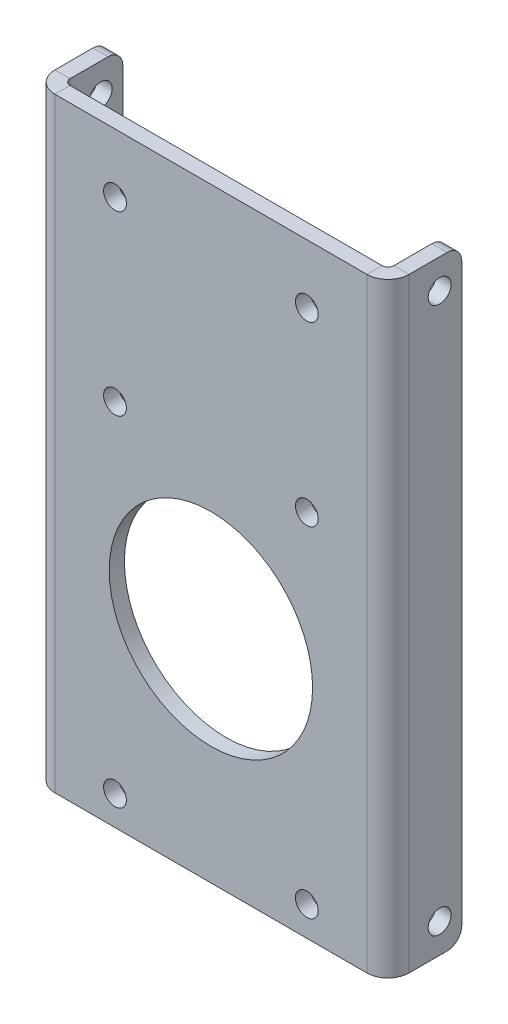
from build123d import *

# Parameters (mm, degrees)
SKETCH1_W                      = 76.2
SKETCH1_H                      = 130.175
BASE_FLANGE1_DEPTH             = 3.2639
EDGE_FLANGE1_STRIP_W           = 15.5956
EDGE_FLANGE1_STRIP_H           = 3.2639
EDGE_FLANGE1_STRIP_CUT_DEPTH   = 130.175
EDGE_FLANGE1_STRIP_2_W         = 15.5956
EDGE_FLANGE1_STRIP_2_H         = 3.2639
EDGE_FLANGE1_STRIP_CUT_2_DEPTH = 130.175
EDGE_FLANGE1_DEPTH             = 130.175
EDGE_FLANGE1_BEND_DEPTH        = 130.175
F_10_0_1935_DIAMETER_HOLE1_D   = 4.9149
SKETCH32_R                     = 21.87575
CUT_EXTRUDE1_DEPTH             = 93.055303045
F_10_0_1935_DIAMETER_HOLE2_D   = 4.9149
FILLET1_R                      = 3.175
F_10_0_1935_DIAMETER_HOLE3_D   = 4.9149


# Sheet-metal steps are written as plain solids
with BuildPart() as part:
    # Sketch1 → Base-Flange1 (new body)
    with BuildSketch(Plane.XY):
        with Locations((0, 17.758918)):
            Rectangle(SKETCH1_W, SKETCH1_H)
    extrude(amount=-BASE_FLANGE1_DEPTH)

    # Edge-Flange1 strip (across the edge) → Edge-Flange1 strip cut (cut)
    with BuildSketch(Plane(origin=(38.1, 82.846418, -3.2639), x_dir=(-1, 0, 0), z_dir=(0, -1, 0))):
        with Locations((-3.2639, -1.63195)):
            Rectangle(EDGE_FLANGE1_STRIP_W, EDGE_FLANGE1_STRIP_H)
    extrude(amount=EDGE_FLANGE1_STRIP_CUT_DEPTH, mode=Mode.SUBTRACT)

    # Edge-Flange1 strip 2 (across the edge) → Edge-Flange1 strip cut 2 (cut)
    with BuildSketch(Plane(origin=(-38.1, -47.328582, -3.2639), x_dir=(1, 0, 0), z_dir=(0, 1, 0))):
        with Locations((-3.2639, -1.63195)):
            Rectangle(EDGE_FLANGE1_STRIP_2_W, EDGE_FLANGE1_STRIP_2_H)
    extrude(amount=EDGE_FLANGE1_STRIP_CUT_2_DEPTH, mode=Mode.SUBTRACT)

    # Edge-Flange1 section (across the edge) → Edge-Flange1 (add)
    with BuildSketch(Plane(origin=(38.1, 82.846418, -3.2639), x_dir=(-1, 0, 0), z_dir=(0, -1, 0))):
        with BuildLine():
            Line((0, 1.27), (0, 12.6111))
            Line((0, 12.6111), (3.2639, 12.6111))
            Line((3.2639, 12.6111), (3.2639, 1.27))
            ThreePointArc((3.2639, 1.27), (3.635874388, 0.371974388), (4.5339, 0))
            Line((4.5339, 0), (4.5339, -3.2639))
            ThreePointArc((4.5339, -3.2639), (1.327948565, -1.935951435), (0, 1.27))
        make_face()
    extrude(amount=EDGE_FLANGE1_DEPTH)

    # Edge-Flange1 section 2 (across the edge) → Edge-Flange1 bend (add)
    with BuildSketch(Plane(origin=(-38.1, -47.328582, -3.2639), x_dir=(1, 0, 0), z_dir=(0, 1, 0))):
        with BuildLine():
            Line((0, 1.27), (0, 12.6111))
            Line((0, 12.6111), (3.2639, 12.6111))
            Line((3.2639, 12.6111), (3.2639, 1.27))
            ThreePointArc((3.2639, 1.27), (3.635874388, 0.371974388), (4.5339, 0))
            Line((4.5339, 0), (4.5339, -3.2639))
            ThreePointArc((4.5339, -3.2639), (1.327948565, -1.935951435), (0, 1.27))
        make_face()
    extrude(amount=EDGE_FLANGE1_BEND_DEPTH)

    # #10 (0.1935) Diameter Hole1 (through all)
    with Locations(Plane(origin=(38.1, 0, 0), x_dir=(0, 0, -1), z_dir=(1, 0, 0))):
        with Locations((11.1125, 76.496418), (11.1125, -40.978582)):
            Hole(F_10_0_1935_DIAMETER_HOLE1_D / 2)

    # Sketch32 → Cut-Extrude1 (cut, through all)
    with BuildSketch(Plane(origin=(0, 0, -3.2639), x_dir=(-1, 0, 0), z_dir=(0, 0, -1))):
        Circle(SKETCH32_R)
    extrude(amount=-CUT_EXTRUDE1_DEPTH, mode=Mode.SUBTRACT)

    # #10 (0.1935) Diameter Hole2 (through all)
    with Locations(Plane.XY):
        with Locations((-20.6375, -40.978582), (20.6375, -40.978582)):
            Hole(F_10_0_1935_DIAMETER_HOLE2_D / 2)

    # Fillet1
    fillet1_edges = [part.edges().sort_by_distance(p)[0] for p in [
        (36.46805, 82.846418, -15.875),
        (36.46805, -47.328582, -15.875),
        (-36.46805, -47.328582, -15.875),
        (-36.46805, 82.846418, -15.875),
    ]]
    fillet(fillet1_edges, radius=FILLET1_R)

    # #10 (0.1935) Diameter Hole3 (through all)
    with Locations(Plane.XY):
        with Locations((-20.6375, 70.146418), (20.6375, 70.146418), (20.6375, 32.046418), (-20.6375, 32.046418)):
            Hole(F_10_0_1935_DIAMETER_HOLE3_D / 2)


solid = part.part
